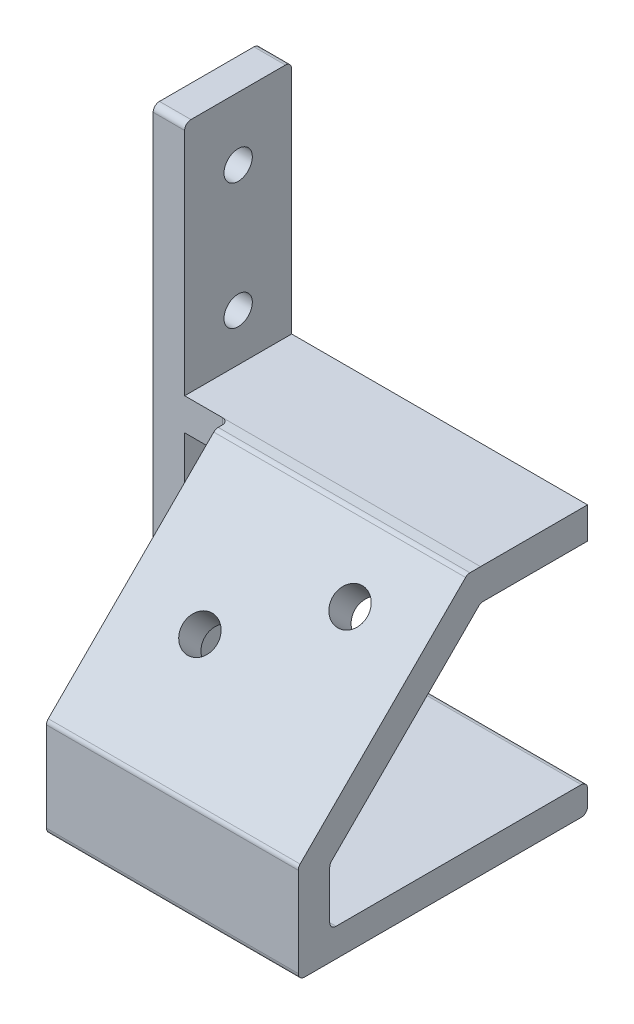
from build123d import *
from build123d.topology import SkipClean

# Parameters (mm, degrees)
SKETCH1_W           = 17
SKETCH1_H           = 80
BOSS_EXTRUDE1_DEPTH = 5
SKETCH2_R           = 2.25
CUT_EXTRUDE1_DEPTH  = 82.939001702
SKETCH3_W           = 17
SKETCH3_H           = 5
SKETCH3_H_2         = 4.5
BOSS_EXTRUDE2_DEPTH = 7
BOSS_EXTRUDE3_DEPTH = 40
CUT_EXTRUDE2_REACH  = 89.054
SKETCH6_R           = 2.75
FILLET1_START       = 5
FILLET1_DEPTH       = 48
FILLET1_START_2     = -1
FILLET1_2_DEPTH     = 13
FILLET1_START_3     = 10.9999999
FILLET1_3_DEPTH     = 4.7752001
FILLET1_START_4     = 12
FILLET1_4_DEPTH     = 40
FILLET1_5_DEPTH     = 12
FILLET1_6_DEPTH     = 43.5
FILLET1_7_DEPTH     = 16.909322952


with BuildPart() as part:
    # Sketch1 → Boss-Extrude1 (new body)
    with BuildSketch(Plane(origin=(0, 0, 0), x_dir=(0, 0, -1), z_dir=(1, 0, 0))):
        with Locations((8.5, 40)):
            Rectangle(SKETCH1_W, SKETCH1_H)
    extrude(amount=BOSS_EXTRUDE1_DEPTH)

    # Sketch2 → Cut-Extrude1 (cut, through all)
    with BuildSketch(Plane(origin=(5, 0, 0), x_dir=(0, 0, -1), z_dir=(1, 0, 0))):
        with Locations((8.5, 10)):
            Circle(SKETCH2_R)
        with Locations((8.5, 30)):
            Circle(SKETCH2_R)
        with Locations((8.5, 50)):
            Circle(SKETCH2_R)
        with Locations((8.5, 70)):
            Circle(SKETCH2_R)
    extrude(amount=-CUT_EXTRUDE1_DEPTH, mode=Mode.SUBTRACT)

    # Sketch3 → Boss-Extrude2 (add)
    with BuildSketch(Plane(origin=(5, 0, 0), x_dir=(0, 0, -1), z_dir=(1, 0, 0))):
        with Locations((8.5, 40)):
            Rectangle(SKETCH3_W, SKETCH3_H)
        with Locations((8.5, 2.25)):
            Rectangle(SKETCH3_W, SKETCH3_H_2)
    extrude(amount=BOSS_EXTRUDE2_DEPTH)

    # Sketch5 → Boss-Extrude3 (add)
    with BuildSketch(Plane(origin=(12, 0, 0), x_dir=(0, 0, -1), z_dir=(1, 0, 0))):
        Polygon((0, 37.5), (-23.954638078, 13.545361922), (-23.954638078, 4.5), (17, 4.5), (17, 0), (-28.954638078, 0), (-28.954638078, 5), (-28.954638078, 15.616429734), (-2.084580393, 42.486487419), (0, 42.5), (17, 42.5), (17, 37.5), align=None)
    extrude(amount=BOSS_EXTRUDE3_DEPTH)

    # Sketch6 → Cut-Extrude2 (cut, up to next)
    with BuildSketch(Plane(origin=(0, 22.285533906, 22.285533906), x_dir=(1, 0, 0), z_dir=(0, 0.7071067811865482, 0.7071067811865468)), mode=Mode.PRIVATE) as cut_extrude2_sk1:
        with Locations(Location((40.25, 18.818462431, 0), (0, 0, 270))):
            Circle(SKETCH6_R)
    cut_extrude2_tool1 = extrude(cut_extrude2_sk1.sketch, amount=-CUT_EXTRUDE2_REACH, mode=Mode.PRIVATE) & part.part
    # Sketch6 → Cut-Extrude2 (cut, up to next)
    with BuildSketch(Plane(origin=(0, 22.285533906, 22.285533906), x_dir=(1, 0, 0), z_dir=(0, 0.7071067811865482, 0.7071067811865468)), mode=Mode.PRIVATE) as cut_extrude2_sk2:
        with Locations(Location((24.25, 7.718462431, 0), (0, 0, 270))):
            Circle(SKETCH6_R)
    cut_extrude2_tool2 = extrude(cut_extrude2_sk2.sketch, amount=-CUT_EXTRUDE2_REACH, mode=Mode.PRIVATE) & part.part
    add(cut_extrude2_tool1.solids().sort_by_distance((40.25, 35.592196, 8.978872))[0], mode=Mode.SUBTRACT)
    add(cut_extrude2_tool2.solids().sort_by_distance((24.25, 27.743311, 16.827757))[0], mode=Mode.SUBTRACT)

    # Fillet1: read off the stored shape, not the designer's step
    # Fillet1 outline → Fillet1 (cut)
    with BuildSketch(Plane.YZ.offset(FILLET1_START)):
        with BuildLine():
            Line((4.5, -17), (4.5, -16))
            ThreePointArc((4.5, -16), (4.207106781, -16.707106781), (3.5, -17))
            Line((3.5, -17), (4.5, -17))
        make_face()
        with BuildLine():
            Line((0, -17), (1, -17))
            ThreePointArc((1, -17), (0.292893219, -16.707106781), (0, -16))
            Line((0, -16), (0, -17))
        make_face()
        with BuildLine():
            Line((0, 28.954638078), (0, 27.954638078))
            ThreePointArc((0, 27.954638078), (0.292893219, 28.661744859), (1, 28.954638078))
            Line((1, 28.954638078), (0, 28.954638078))
        make_face()
        with BuildLine():
            ThreePointArc((42.19627557, 2.374792242), (42.411803181, 2.053361203), (42.48914778, 1.674167483))
            Line((42.48914778, 1.674167483), (42.486487419, 2.084580393))
            Line((42.486487419, 2.084580393), (42.19627557, 2.374792242))
        make_face()
        with BuildLine():
            Line((15.616429734, 28.954638078), (15.202216171, 28.954638078))
            ThreePointArc((15.202216171, 28.954638078), (15.584899604, 28.878517611), (15.909322952, 28.661744859))
            Line((15.909322952, 28.661744859), (15.616429734, 28.954638078))
        make_face()
    extrude(amount=FILLET1_DEPTH, mode=Mode.SUBTRACT)

    # Fillet1 2 outline → Fillet1 2 (cut)
    with BuildSketch(Plane.YZ.offset(FILLET1_START_2)):
        with BuildLine():
            Line((0, -17), (1, -17))
            ThreePointArc((1, -17), (0.292893219, -16.707106781), (0, -16))
            Line((0, -16), (0, -17))
        make_face()
        with BuildLine():
            ThreePointArc((0, -1), (0.292893219, -0.292893219), (1, 0))
            Line((1, 0), (0, 0))
            Line((0, 0), (0, -1))
        make_face()
        with BuildLine():
            ThreePointArc((80, -16), (79.707106781, -16.707106781), (79, -17))
            Line((79, -17), (80, -17))
            Line((80, -17), (80, -16))
        make_face()
        with BuildLine():
            Line((80, 0), (79, 0))
            ThreePointArc((79, 0), (79.707106781, -0.292893219), (80, -1))
            Line((80, -1), (80, 0))
        make_face()
    extrude(amount=FILLET1_2_DEPTH, mode=Mode.SUBTRACT)

    # Fillet1 3 outline → Fillet1 3 (add)
    with SkipClean():  # the faces are left unmerged after this step: merging them gives an invalid solid
        with BuildSketch(Plane.YZ.offset(FILLET1_START_3)):
            with BuildLine():
                Line((4.5, 0), (4.5, 23.954638078))
                Line((4.5, 23.954638078), (13.545361922, 23.954638078))
                Line((13.545361922, 23.954638078), (37.207106781, 0.292893219))
                ThreePointArc((37.207106781, 0.292893219), (37.423879533, -0.03153013), (37.5, -0.414213562))
                Line((37.5, -0.414213562), (37.5, 0))
                Line((37.5, 0), (42.5, 0))
                Line((42.5, 0), (42.48914778, 1.674167483))
                ThreePointArc((42.48914778, 1.674167483), (42.411803181, 2.053361203), (42.19627557, 2.374792242))
                Line((42.19627557, 2.374792242), (15.909322952, 28.661744859))
                ThreePointArc((15.909322952, 28.661744859), (15.584899604, 28.878517611), (15.202216171, 28.954638078))
                Line((15.202216171, 28.954638078), (1, 28.954638078))
                ThreePointArc((1, 28.954638078), (0.292893219, 28.661744859), (0, 27.954638078))
                Line((0, 27.954638078), (0, 0))
                Line((0, 0), (4.5, 0))
            make_face()
        extrude(amount=FILLET1_3_DEPTH)
    add(part.part.scale(1), mode=Mode.REPLACE)  # the faces are merged on a copy

    # Fillet1 4 outline → Fillet1 4 (add)
    with BuildSketch(Plane.YZ.offset(FILLET1_START_4)):
        with BuildLine():
            Line((37.5, -0.414213562), (37.5, 0))
            Line((37.5, 0), (37.207106781, 0.292893219))
            ThreePointArc((37.207106781, 0.292893219), (37.423879533, -0.03153013), (37.5, -0.414213562))
        make_face()
        with BuildLine():
            Line((4.5, 23.954638078), (4.5, 22.954638078))
            ThreePointArc((4.5, 22.954638078), (4.792893219, 23.661744859), (5.5, 23.954638078))
            Line((5.5, 23.954638078), (4.5, 23.954638078))
        make_face()
        with BuildLine():
            ThreePointArc((13.131148359, 23.954638078), (13.513831792, 23.878517611), (13.838255141, 23.661744859))
            Line((13.838255141, 23.661744859), (13.545361922, 23.954638078))
            Line((13.545361922, 23.954638078), (13.131148359, 23.954638078))
        make_face()
    extrude(amount=FILLET1_4_DEPTH)

    # Fillet1 5 outline → Fillet1 5 (add)
    with BuildSketch(Plane.YZ):
        with BuildLine():
            Line((37.5, 0), (37.410179722, 0))
            ThreePointArc((37.410179722, 0), (37.47728699, -0.202293437), (37.5, -0.414213562))
            Line((37.5, -0.414213562), (37.5, 0))
        make_face()
    extrude(amount=FILLET1_5_DEPTH)

    # Fillet1 6 outline → Fillet1 6 (cut)
    with BuildSketch(Plane(origin=(0, 0, 0), x_dir=(1, 0, 0), z_dir=(0, 1, 0)).offset(FILLET1_START_2)):
        with BuildLine():
            Line((10.9999999, -28.954638078), (12, -28.954638078))
            Line((12, -28.954638078), (12, -1))
            ThreePointArc((12, -1), (11.707106781, -0.292893219), (11, 0))
            Line((11, 0), (10.9999999, -28.954638078))
        make_face()
    extrude(amount=FILLET1_6_DEPTH, mode=Mode.SUBTRACT)

    # Fillet1 7 outline → Fillet1 7 (cut)
    with BuildSketch(Plane(origin=(0, 0, 0), x_dir=(1, 0, 0), z_dir=(0, 1, 0)).offset(FILLET1_START_2)):
        with BuildLine():
            Line((12, 0), (11, 0))
            ThreePointArc((11, 0), (11.707106781, -0.292893219), (12, -1))
            Line((12, -1), (12, 0))
        make_face()
    extrude(amount=FILLET1_7_DEPTH, mode=Mode.SUBTRACT)


solid = part.part
